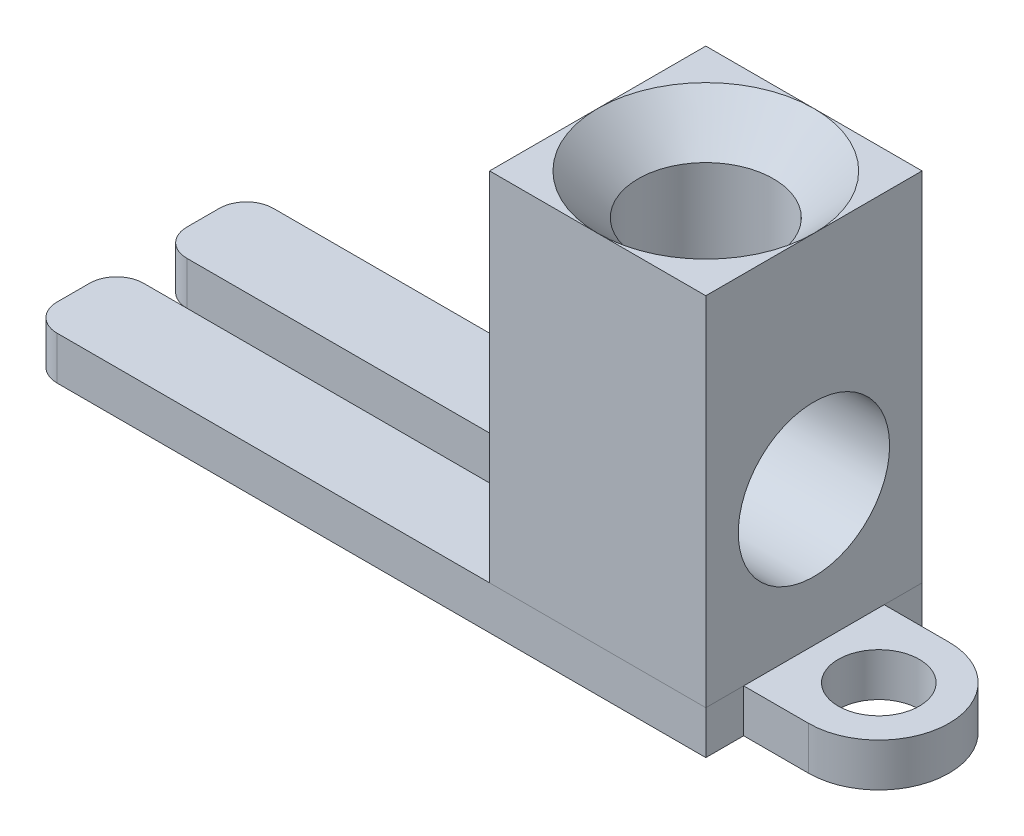
from build123d import *

# Parameters (mm, degrees)
TERMINALBODYS_W             = 4
TERMINALBODYS_H             = 4
TERMINAL_BODY_DEPTH         = 6.6
WIRE_ACCESS_DEPTH           = 8.180529228
WIRE_ACCESS_DEPTH_BACK      = 8.180529228
WIREACCESSS_R               = 1.4
SOLDERCONNECTIONS_R         = 0.75
SOLDER_CONNECTION_DEPTH     = 0.8
SOLDERCONNECTIONCUTS_W      = 8.5
SOLDERCONNECTIONCUTS_H      = 0.8
SOLDER_CONNECTION_CUT_DEPTH = 13.562245022
SCF_R                       = 0.5


# Read off the part's stored shape, not the designer's step: M3x0.5 Tapped Hole1
with BuildPart() as part:
    # TerminalBodyS → TERMINAL BODY (new body)
    with BuildSketch(Plane(origin=(0, 0, 0), x_dir=(1, 0, 0), z_dir=(0, 1, 0))):
        Rectangle(TERMINALBODYS_W, TERMINALBODYS_H)
    extrude(amount=TERMINAL_BODY_DEPTH)

    # WireAccessS → WIRE ACCESS (cut, two sides: drawn at the far end of the back side and taken through both)
    with BuildSketch(Plane(origin=(0, 0, 0), x_dir=(0, 0, -1), z_dir=(1, 0, 0)).offset(-WIRE_ACCESS_DEPTH_BACK)):
        with Locations((0, 2.5)):
            Circle(WIREACCESSS_R)
    extrude(amount=WIRE_ACCESS_DEPTH + WIRE_ACCESS_DEPTH_BACK, mode=Mode.SUBTRACT)

    # M3x0.5 Tapped Hole1 outline → M3x0.5 Tapped Hole1 (revolve, cut)
    with BuildSketch(Plane.XY):
        Polygon((0, 3.129982186), (1.25, 3.129982186), (1.25, 5.85), (2, 6.6), (0, 6.6), align=None)
    revolve(axis=Axis((0, 0, 0), (0, 1, 0)), mode=Mode.SUBTRACT)


with BuildPart() as body_2:
    # SolderConnectionS → SOLDER CONNECTION (new body)
    with BuildSketch(Plane(origin=(0, 0, 0), x_dir=(1, 0, 0), z_dir=(0, 1, 0))):
        with BuildLine():
            Line((2, 1.3), (3.2, 1.3))
            ThreePointArc((3.2, 1.3), (4.5, 0), (3.2, -1.3))
            Line((3.2, -1.3), (2, -1.3))
            Line((2, -1.3), (2, -2))
            Line((2, -2), (-10.5, -2))
            Line((-10.5, -2), (-10.5, 2))
            Line((-10.5, 2), (2, 2))
            Line((2, 2), (2, 1.3))
        make_face()
        with Locations(Location((3.2, 0, 0), (0, 0, 270))):
            Circle(SOLDERCONNECTIONS_R, mode=Mode.SUBTRACT)
    extrude(amount=-SOLDER_CONNECTION_DEPTH)

    # SolderConnectionCutS → SOLDER CONNECTION CUT (cut, through all)
    with BuildSketch(Plane(origin=(0, 0, 0), x_dir=(-1, 0, 0), z_dir=(0, 1, 0))):
        with Locations((6.25, 0)):
            Rectangle(SOLDERCONNECTIONCUTS_W, SOLDERCONNECTIONCUTS_H)
    extrude(amount=-SOLDER_CONNECTION_CUT_DEPTH, mode=Mode.SUBTRACT)

    # SCF
    scf_edges = [body_2.edges().sort_by_distance(p)[0] for p in [
        (-10.5, -0.4, 2),
        (-10.5, -0.4, -2),
        (-10.5, -0.4, 0.4),
        (-10.5, -0.4, -0.4),
    ]]
    fillet(scf_edges, radius=SCF_R)


solid = Compound([part.part, body_2.part])
